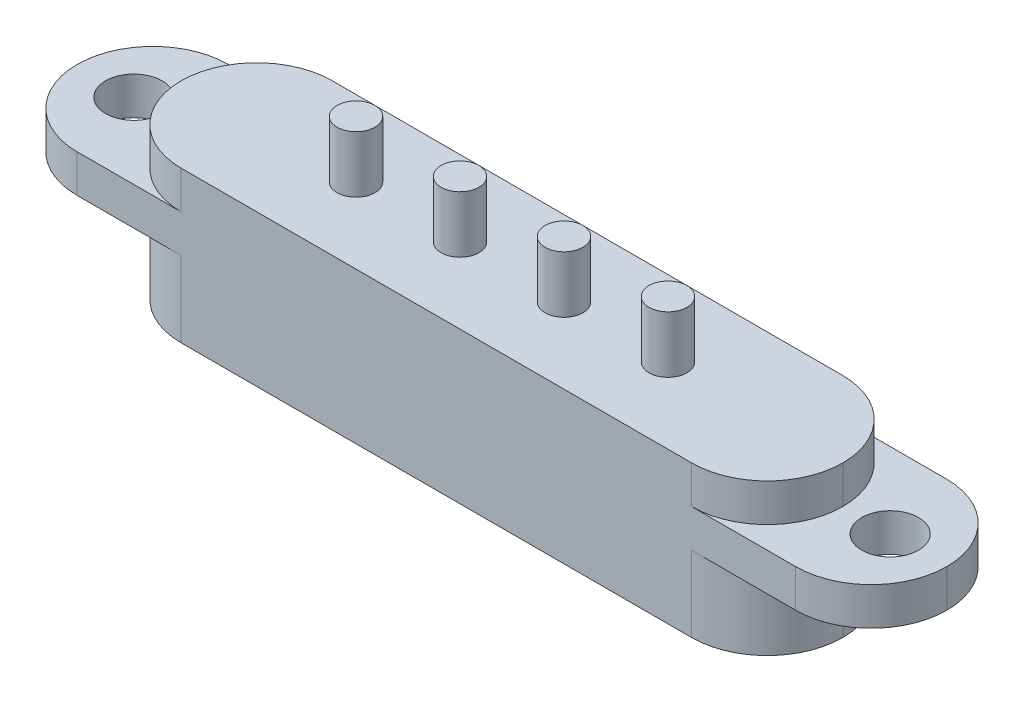
from build123d import *

# Parameters (mm, degrees)
SKETCH1_W           = 23
SKETCH1_H           = 4
SKETCH1_R           = 0.75
BOSS_EXTRUDE1_DEPTH = 1
SKETCH2_W           = 17.5
SKETCH2_H           = 4
BOSS_EXTRUDE2_DEPTH = 1
SKETCH3_W           = 17.5
SKETCH3_H           = 4
BOSS_EXTRUDE3_DEPTH = 2
SKETCH4_R           = 0.5
BOSS_EXTRUDE4_DEPTH = 1.5
FILLET1_R           = 2
FILLET2_R           = 2


with BuildPart() as part:
    # Sketch1 → Boss-Extrude1 (new body)
    with BuildSketch(Plane(origin=(0, 0, 0), x_dir=(1, 0, 0), z_dir=(0, 1, 0))):
        with Locations((11.5, -2)):
            Rectangle(SKETCH1_W, SKETCH1_H)
        with Locations(Location((1.5, -2, 0), (0, 0, 270))):
            Circle(SKETCH1_R, mode=Mode.SUBTRACT)
        with Locations(Location((21.5, -2, 0), (0, 0, 270))):
            Circle(SKETCH1_R, mode=Mode.SUBTRACT)
    extrude(amount=BOSS_EXTRUDE1_DEPTH)

    # Sketch2 → Boss-Extrude2 (add)
    with BuildSketch(Plane(origin=(0, 1, 0), x_dir=(1, 0, 0), z_dir=(0, 1, 0))):
        with Locations((11.5, -2)):
            Rectangle(SKETCH2_W, SKETCH2_H)
    extrude(amount=BOSS_EXTRUDE2_DEPTH)

    # Sketch3 → Boss-Extrude3 (add)
    with BuildSketch(Plane(origin=(0, 0, 0), x_dir=(-1, 0, 0), z_dir=(0, -1, 0))):
        with Locations((-11.5, -2)):
            Rectangle(SKETCH3_W, SKETCH3_H)
    extrude(amount=BOSS_EXTRUDE3_DEPTH)

    # Sketch4 → Boss-Extrude4 (add)
    with BuildSketch(Plane(origin=(0, 2, 0), x_dir=(1, 0, 0), z_dir=(0, 1, 0))):
        with Locations(Location((7.375, -2, 0), (0, 0, 270))):
            Circle(SKETCH4_R)
        with Locations(Location((10.125, -2, 0), (0, 0, 270))):
            Circle(SKETCH4_R)
        with Locations(Location((12.875, -2, 0), (0, 0, 270))):
            Circle(SKETCH4_R)
        with Locations(Location((15.625, -2, 0), (0, 0, 270))):
            Circle(SKETCH4_R)
    extrude(amount=BOSS_EXTRUDE4_DEPTH)

    # Fillet1
    fillet1_edges = [part.edges().sort_by_distance(p)[0] for p in [
        (20.25, -1, 4),
        (20.25, -1, 0),
        (20.25, 1.5, 0),
        (20.25, 1.5, 4),
        (2.75, 1.5, 4),
        (2.75, 1.5, 0),
        (2.75, -1, 0),
        (2.75, -1, 4),
    ]]
    fillet(fillet1_edges, radius=FILLET1_R - 0.0001)  # a hair under: the kernel refuses the full size

    # Fillet2
    fillet2_edges = [part.edges().sort_by_distance(p)[0] for p in [
        (0, 0.5, 4),
        (0, 0.5, 0),
        (23, 0.5, 0),
        (23, 0.5, 4),
    ]]
    fillet(fillet2_edges, radius=FILLET2_R - 0.0001)  # a hair under: the kernel refuses the full size


solid = part.part
